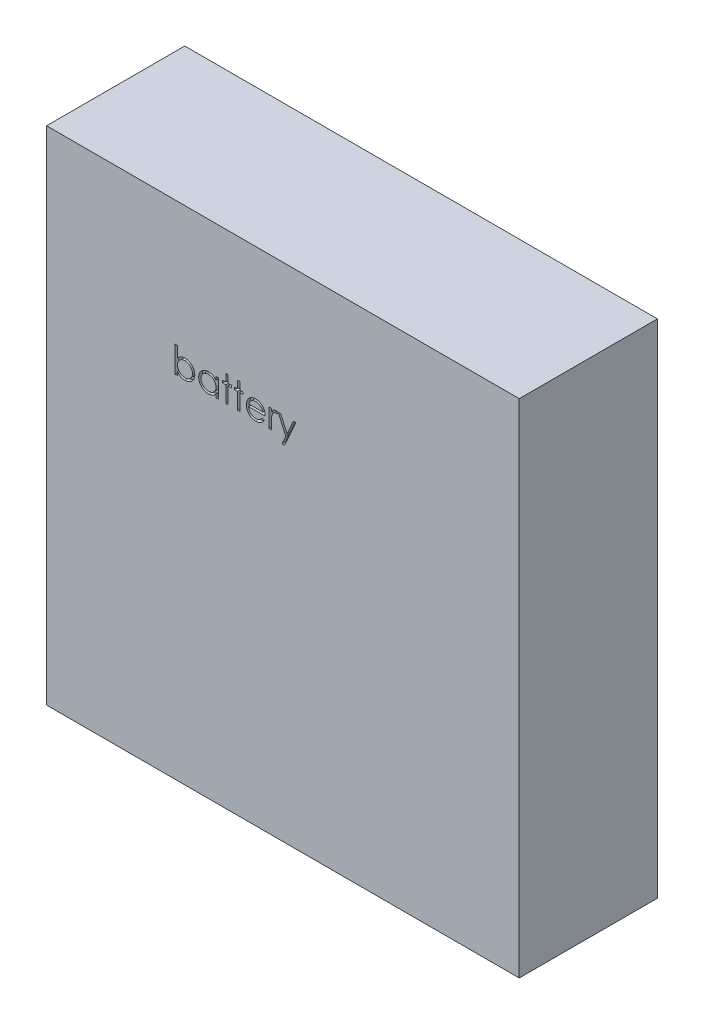
from build123d import *

# Parameters (mm, degrees)
SKETCH1_W           = 65
SKETCH1_H           = 69
BOSS_EXTRUDE1_DEPTH = 19
CUT_EXTRUDE1_DEPTH  = 0.5


with BuildPart() as part:
    # Sketch1 → Boss-Extrude1 (new body)
    with BuildSketch(Plane.XY):
        with Locations((32.5, 34.5)):
            Rectangle(SKETCH1_W, SKETCH1_H)
    extrude(amount=BOSS_EXTRUDE1_DEPTH)

    # Sketch2 → Cut-Extrude1 (cut)
    # profile 1 of 7: a face of its own
    with BuildSketch(Plane.XY.offset(19)):
        with BuildLine():
            Line((17.685046553, 48.241424132), (17.685046553, 51.831167722))
            Line((17.685046553, 51.831167722), (17.999149117, 51.831167722))
            Line((17.999149117, 51.831167722), (17.999149117, 50.334973811))
            add(Edge.make_bspline(
                [(17.999149117, 50.334973811), (18.034542536, 50.375731743), (18.103596556, 50.455252149), (18.219373007, 50.559099798), (18.340778576, 50.647152276), (18.468736832, 50.719738394), (18.603429765, 50.775012001), (18.744161874, 50.815434391), (18.891292915, 50.839821294), (18.991612089, 50.842587367), (19.042418348, 50.843988234)],
                knots=[0, 0, 0, 0, 1.077089805, 2.101446609, 3.097517232, 4.067117542, 5.031729543, 5.997785507, 6.985986182, 8, 8, 8, 8], degree=3))
            add(Edge.make_bspline(
                [(19.042418348, 50.843988234), (19.087584486, 50.842748006), (19.176885638, 50.840295864), (19.308167785, 50.821661368), (19.43448106, 50.791443567), (19.555756708, 50.749551387), (19.67142884, 50.69396841), (19.782487897, 50.627427102), (19.888364882, 50.548188773), (19.987419767, 50.457590462), (20.078713654, 50.359233839), (20.158626164, 50.254053524), (20.22612586, 50.143578434), (20.281957153, 50.028178371), (20.325128205, 49.90738202), (20.354870473, 49.781307822), (20.373763937, 49.650079803), (20.376144183, 49.560766999), (20.377354245, 49.515362433)],
                knots=[0, 0, 0, 0, 1.034377878, 2.045141349, 3.03070803, 4.00595497, 4.978199603, 5.965204761, 6.967410914, 8.002051993, 9.036360596, 10.037508045, 11.022711142, 11.997267194, 12.969246472, 13.954813154, 14.960274251, 16, 16, 16, 16], degree=3))
            add(Edge.make_bspline(
                [(20.377354245, 49.515362433), (20.376117805, 49.470662415), (20.373679739, 49.38252102), (20.355058431, 49.252814464), (20.324312166, 49.127975765), (20.280350983, 49.008327507), (20.225086044, 48.893307594), (20.155974768, 48.78422719), (20.076163769, 48.679188214), (19.98383262, 48.581564583), (19.883919068, 48.491331183), (19.777004825, 48.412925318), (19.665782903, 48.345208198), (19.548519791, 48.29155275), (19.426951749, 48.248151829), (19.299776363, 48.218034138), (19.167713135, 48.200461083), (19.077994246, 48.197865516), (19.032602643, 48.196552337)],
                knots=[0, 0, 0, 0, 1.024244038, 2.01964794, 2.996620209, 3.965911562, 4.936179293, 5.91563013, 6.920572822, 7.955171681, 8.990768464, 10.002129126, 10.989675881, 11.969873457, 12.952483066, 13.943799762, 14.959703725, 16, 16, 16, 16], degree=3))
            add(Edge.make_bspline(
                [(19.032602643, 48.196552337), (18.980637531, 48.197992945), (18.878743006, 48.200817727), (18.729690341, 48.224236706), (18.588608791, 48.264098316), (18.453891243, 48.317660072), (18.32746352, 48.390188726), (18.208522938, 48.480145476), (18.097819565, 48.589012613), (18.03260275, 48.672074103), (17.999149117, 48.714681343)],
                knots=[0, 0, 0, 0, 1.035807596, 2.031038093, 2.998900396, 3.954262848, 4.914341711, 5.895762244, 6.92060972, 8, 8, 8, 8], degree=3))
            Line((17.999149117, 48.714681343), (17.999149117, 48.241424132))
            Line((17.999149117, 48.241424132), (17.685046553, 48.241424132))
        make_face()
        with BuildLine():
            add(Edge.make_bspline(
                [(19.029798156, 48.510654901), (19.075712508, 48.51228853), (19.166340137, 48.515513054), (19.299383927, 48.540686677), (19.426698137, 48.582570791), (19.547641219, 48.639854499), (19.660320531, 48.711876534), (19.760973165, 48.799022704), (19.850452875, 48.898524219), (19.925104651, 49.010757912), (19.987430895, 49.130208881), (20.030244171, 49.255863183), (20.058963893, 49.384357972), (20.061816191, 49.471504016), (20.063251681, 49.515362433)],
                knots=[0, 0, 0, 0, 1.031910345, 2.036826888, 3.032245421, 4.038315463, 5.03827337, 6.029480047, 7.023177075, 8.037597977, 9.052889626, 10.043399556, 11.015292101, 12, 12, 12, 12], degree=3))
            add(Edge.make_bspline(
                [(20.063251681, 49.515362433), (20.061363937, 49.559177975), (20.057595986, 49.646634136), (20.031221203, 49.776283803), (19.985163413, 49.901871428), (19.92404539, 50.023049416), (19.848177405, 50.136057217), (19.759171441, 50.237547344), (19.657289635, 50.325107328), (19.544466216, 50.398097399), (19.424286025, 50.457656952), (19.297795392, 50.498501978), (19.167637269, 50.525240165), (19.079241776, 50.528329293), (19.034706008, 50.52988567)],
                knots=[0, 0, 0, 0, 0.984795267, 1.965658976, 2.959410029, 3.983795688, 5.009594896, 6.01088574, 7.009236619, 8.019050059, 9.024672985, 10.014834719, 10.999826153, 12, 12, 12, 12], degree=3))
            add(Edge.make_bspline(
                [(19.034706008, 50.52988567), (18.989238501, 50.528330173), (18.898994724, 50.525242826), (18.765826502, 50.498455002), (18.635763218, 50.457407391), (18.511475686, 50.398476041), (18.395621631, 50.326364581), (18.292009019, 50.241624381), (18.202677461, 50.144844473), (18.12913369, 50.036338671), (18.070728891, 49.919153636), (18.028945143, 49.794141433), (18.003945497, 49.66196012), (18.000767364, 49.571326915), (17.999149117, 49.525178138)],
                knots=[0, 0, 0, 0, 1.016820015, 2.018181405, 3.029022337, 4.06341356, 5.088169224, 6.076823655, 7.05054209, 8.02560866, 9.001194327, 9.972267242, 10.967515442, 12, 12, 12, 12], degree=3))
            add(Edge.make_bspline(
                [(17.999149117, 49.525178138), (18.000108788, 49.48984032), (18.001997723, 49.42028431), (18.016428091, 49.31815662), (18.039383753, 49.220423527), (18.071727247, 49.126978532), (18.114228482, 49.038352092), (18.165438747, 48.953856012), (18.226390394, 48.874252734), (18.295296983, 48.799737414), (18.371259364, 48.731927999), (18.452782483, 48.673149774), (18.538200414, 48.622535584), (18.628490384, 48.582190742), (18.722601675, 48.549264221), (18.821500016, 48.527530475), (18.92417144, 48.512555436), (18.994218538, 48.511295083), (19.029798156, 48.510654901)],
                knots=[0, 0, 0, 0, 1.050331198, 2.067384183, 3.060053655, 4.031335885, 5.001026174, 5.976994447, 6.963687968, 7.976578778, 8.990422448, 9.985569286, 10.960374351, 11.936812464, 12.921228065, 13.919088064, 14.943024695, 16, 16, 16, 16], degree=3))
        make_face(mode=Mode.SUBTRACT)
    # profile 2 of 7: a face of its own
    with BuildSketch(Plane.XY.offset(19)):
        with BuildLine():
            Line((23.608123476, 50.79911644), (23.608123476, 48.241424132))
            Line((23.608123476, 48.241424132), (23.294020912, 48.241424132))
            Line((23.294020912, 48.241424132), (23.294020912, 48.683831984))
            add(Edge.make_bspline(
                [(23.294020912, 48.683831984), (23.258602121, 48.643792391), (23.189481906, 48.565654619), (23.074040788, 48.463572447), (22.95167261, 48.379194125), (22.822971289, 48.31104421), (22.688053046, 48.259852153), (22.547216959, 48.223465994), (22.400405578, 48.200072159), (22.300153223, 48.197736137), (22.249349438, 48.196552337)],
                knots=[0, 0, 0, 0, 1.074387032, 2.096679803, 3.090159297, 4.057316773, 5.018401886, 5.985159533, 6.978961417, 8, 8, 8, 8], degree=3))
            add(Edge.make_bspline(
                [(22.249349438, 48.196552337), (22.204181484, 48.197778709), (22.115108279, 48.20019717), (21.984079202, 48.218959473), (21.857986952, 48.249090095), (21.73671238, 48.290990984), (21.621040234, 48.346571806), (21.509980138, 48.413113054), (21.404107446, 48.492353884), (21.305035907, 48.582941913), (21.213803906, 48.6813369), (21.133742634, 48.786282447), (21.066989554, 48.897324751), (21.011169473, 49.013057904), (20.968173129, 49.134372824), (20.938199494, 49.260849992), (20.919459048, 49.392339865), (20.917041587, 49.481879389), (20.915815784, 49.527281504)],
                knots=[0, 0, 0, 0, 1.033919861, 2.038935746, 3.024066025, 3.998881131, 4.97069526, 5.957263378, 6.95902576, 7.993208707, 9.027059324, 10.027763471, 11.009749337, 11.988697705, 12.965288445, 13.950418724, 14.960734635, 16, 16, 16, 16], degree=3))
            add(Edge.make_bspline(
                [(20.915815784, 49.527281504), (20.917068755, 49.571745207), (20.919545812, 49.659647551), (20.937999032, 49.788926249), (20.969030041, 49.913444509), (21.012577888, 50.032801453), (21.068419843, 50.147141503), (21.13634793, 50.256545528), (21.216367055, 50.361314925), (21.308619462, 50.458986152), (21.408554232, 50.549206766), (21.515462963, 50.627615812), (21.626686244, 50.695332661), (21.743949255, 50.748986137), (21.86551636, 50.792395241), (21.992469805, 50.822428209), (22.124281384, 50.840125531), (22.213771876, 50.842688295), (22.259165143, 50.843988234)],
                knots=[0, 0, 0, 0, 1.020392517, 2.01726096, 2.990465484, 3.961182959, 4.928053699, 5.906110375, 6.912531644, 7.948652711, 8.985773172, 9.998621852, 10.987621588, 11.969261332, 12.953316658, 13.946091881, 14.958173133, 16, 16, 16, 16], degree=3))
            add(Edge.make_bspline(
                [(22.259165143, 50.843988234), (22.311365002, 50.842550483), (22.413726462, 50.83973112), (22.563454471, 50.816268393), (22.705098949, 50.776629926), (22.839753301, 50.722712428), (22.966933987, 50.651063698), (23.085436971, 50.560683737), (23.196502455, 50.45214255), (23.260882746, 50.368772106), (23.294020912, 50.325859228)],
                knots=[0, 0, 0, 0, 1.038897134, 2.037228247, 3.008116434, 3.962042015, 4.918381754, 5.904844433, 6.921570401, 8, 8, 8, 8], degree=3))
            Line((23.294020912, 50.325859228), (23.294020912, 50.79911644))
            Line((23.294020912, 50.79911644), (23.608123476, 50.79911644))
        make_face()
        with BuildLine():
            add(Edge.make_bspline(
                [(22.263371874, 50.52988567), (22.217457536, 50.528252033), (22.126829936, 50.525027492), (21.993785934, 50.499853996), (21.86647252, 50.457969402), (21.745526445, 50.400687501), (21.632858229, 50.328658764), (21.532164558, 50.241537381), (21.442621857, 50.141700367), (21.367313592, 50.029598256), (21.305923095, 49.909420165), (21.262756063, 49.783795727), (21.234286816, 49.65499075), (21.231378295, 49.567628064), (21.229918348, 49.523775895)],
                knots=[0, 0, 0, 0, 1.031046209, 2.035121221, 3.029706178, 4.034933723, 5.034054252, 6.02443088, 7.017295772, 8.038157696, 9.050218397, 10.03989886, 11.016116709, 12, 12, 12, 12], degree=3))
            add(Edge.make_bspline(
                [(21.229918348, 49.523775895), (21.231783241, 49.480185788), (21.235505718, 49.393176432), (21.262256413, 49.264195855), (21.307136286, 49.138541813), (21.368378349, 49.017280819), (21.445064973, 48.904696719), (21.533953626, 48.802956596), (21.635903907, 48.715467008), (21.748831414, 48.642229435), (21.869439385, 48.583066914), (21.996273316, 48.541901274), (22.126948954, 48.515323494), (22.215801288, 48.512219017), (22.260567386, 48.510654901)],
                knots=[0, 0, 0, 0, 0.979072187, 1.954306742, 2.945804271, 3.96968567, 4.997920485, 5.998718438, 6.996577872, 8.005894225, 9.015743152, 10.005417472, 10.995077863, 12, 12, 12, 12], degree=3))
            add(Edge.make_bspline(
                [(22.260567386, 48.510654901), (22.306013889, 48.512314865), (22.396402476, 48.515616369), (22.529841184, 48.540897634), (22.659336146, 48.582666432), (22.783123375, 48.640565559), (22.898439506, 48.712322915), (23.001937384, 48.796330006), (23.089453352, 48.89403319), (23.163645961, 49.001409643), (23.221821378, 49.11912164), (23.264197437, 49.24445583), (23.289251343, 49.377416579), (23.292409073, 49.468280505), (23.294020912, 49.514661311)],
                knots=[0, 0, 0, 0, 1.01762866, 2.023962475, 3.030623092, 4.058876274, 5.077231937, 6.066672613, 7.034107872, 8.005628644, 8.981990164, 9.965428785, 10.961468474, 12, 12, 12, 12], degree=3))
            add(Edge.make_bspline(
                [(23.294020912, 49.514661311), (23.293061256, 49.549999142), (23.291172348, 49.619555175), (23.276741779, 49.721682693), (23.253786852, 49.819416419), (23.221440682, 49.912859108), (23.178949398, 50.001494123), (23.127701632, 50.085957884), (23.066796182, 50.165811095), (22.997213486, 50.239954166), (22.921048284, 50.307580628), (22.840453743, 50.367944869), (22.754474996, 50.417533642), (22.664557959, 50.458574913), (22.570546625, 50.491234063), (22.471676005, 50.513021757), (22.368997018, 50.527982078), (22.298950962, 50.529244459), (22.263371874, 50.52988567)],
                knots=[0, 0, 0, 0, 1.050140795, 2.067009409, 3.05949893, 4.030605086, 5.00011959, 5.97591094, 6.962425594, 7.979863591, 8.993523472, 9.986985069, 10.967611495, 11.937549037, 12.921786183, 13.919465291, 14.943216303, 16, 16, 16, 16], degree=3))
        make_face(mode=Mode.SUBTRACT)
    # profile 3 of 7: a face of its own
    with BuildSketch(Plane.XY.offset(19)):
        Polygon((24.640174758, 51.831167722), (24.954277322, 51.831167722), (24.954277322, 50.79911644), (25.402995271, 50.79911644), (25.402995271, 50.485013876), (24.954277322, 50.485013876), (24.954277322, 48.241424132), (24.640174758, 48.241424132), (24.640174758, 50.485013876), (24.191456809, 50.485013876), (24.191456809, 50.79911644), (24.640174758, 50.79911644), align=None)
    # profile 4 of 7: a face of its own
    with BuildSketch(Plane.XY.offset(19)):
        Polygon((26.255559374, 51.831167722), (26.569661938, 51.831167722), (26.569661938, 50.79911644), (27.018379886, 50.79911644), (27.018379886, 50.485013876), (26.569661938, 50.485013876), (26.569661938, 48.241424132), (26.255559374, 48.241424132), (26.255559374, 50.485013876), (25.806841425, 50.485013876), (25.806841425, 50.79911644), (26.255559374, 50.79911644), align=None)
    # profile 5 of 7: a face of its own
    with BuildSketch(Plane.XY.offset(19)):
        with BuildLine():
            Line((29.656000079, 49.04911644), (29.935046553, 48.902581984))
            add(Edge.make_bspline(
                [(29.935046553, 48.902581984), (29.912809958, 48.863138653), (29.869546349, 48.78639755), (29.795145601, 48.68096569), (29.717153529, 48.586117974), (29.632049561, 48.50438832), (29.542379882, 48.433136935), (29.447647227, 48.37079911), (29.347358409, 48.31768059), (29.241508685, 48.272928062), (29.129209133, 48.238518568), (29.010187617, 48.214214347), (28.884216122, 48.199191078), (28.797869942, 48.197445937), (28.753656329, 48.196552337)],
                knots=[0, 0, 0, 0, 1.120438281, 2.179929193, 3.190490725, 4.156257408, 5.095198341, 6.022838206, 6.959905092, 7.901321166, 8.864066838, 9.862729781, 10.905609505, 12, 12, 12, 12], degree=3))
            add(Edge.make_bspline(
                [(28.753656329, 48.196552337), (28.704514351, 48.197699512), (28.60865259, 48.199937319), (28.469112842, 48.219229784), (28.337733424, 48.250702142), (28.214521721, 48.294667684), (28.099779468, 48.352095008), (27.993278613, 48.42205449), (27.894459087, 48.504186744), (27.806434878, 48.599203188), (27.727190996, 48.700885145), (27.657265176, 48.80684103), (27.598807744, 48.916804254), (27.551255134, 49.030074778), (27.512850269, 49.145938672), (27.486083566, 49.265450139), (27.470653818, 49.388285723), (27.468289372, 49.471383059), (27.467097835, 49.513259068)],
                knots=[0, 0, 0, 0, 1.145258523, 2.234067595, 3.276747158, 4.290159414, 5.277019952, 6.260822364, 7.254936242, 8.264827045, 9.274100331, 10.257902744, 11.220704747, 12.172965371, 13.118907548, 14.062713208, 15.023725156, 16, 16, 16, 16], degree=3))
            add(Edge.make_bspline(
                [(27.467097835, 49.513259068), (27.468156976, 49.552553898), (27.470256055, 49.630431063), (27.483486842, 49.745696607), (27.506935135, 49.85772506), (27.539111459, 49.966609508), (27.580662705, 50.072167642), (27.631494925, 50.174463706), (27.691687302, 50.273388845), (27.738159976, 50.335791979), (27.761568989, 50.367225414)],
                knots=[0, 0, 0, 0, 1.024358464, 2.0301432, 3.019427413, 4.004406732, 4.986367066, 5.972626655, 6.978780325, 8, 8, 8, 8], degree=3))
            add(Edge.make_bspline(
                [(27.761568989, 50.367225414), (27.793276672, 50.405094284), (27.855687618, 50.479632435), (27.961243974, 50.57757076), (28.07554417, 50.659614535), (28.197155796, 50.727621672), (28.32749227, 50.779295319), (28.464801561, 50.817802901), (28.610647147, 50.839380912), (28.710352368, 50.842428745), (28.761368668, 50.843988234)],
                knots=[0, 0, 0, 0, 1.030682036, 2.02871468, 2.997146059, 3.962720338, 4.930598197, 5.918074684, 6.934738563, 8, 8, 8, 8], degree=3))
            add(Edge.make_bspline(
                [(28.761368668, 50.843988234), (28.813816274, 50.842634186), (28.91670652, 50.83997785), (29.066738641, 50.815351517), (29.208699357, 50.776298962), (29.342531862, 50.721145172), (29.468249722, 50.64998562), (29.585035772, 50.561843779), (29.694887284, 50.459425691), (29.758795863, 50.380662482), (29.791316585, 50.340582786)],
                knots=[0, 0, 0, 0, 1.056321875, 2.072262726, 3.055038591, 4.01806755, 4.982017516, 5.957941055, 6.960871419, 8, 8, 8, 8], degree=3))
            add(Edge.make_bspline(
                [(29.791316585, 50.340582786), (29.813443523, 50.310379204), (29.857550117, 50.250173086), (29.912797217, 50.152001929), (29.960754612, 50.049291334), (29.999087573, 49.940381037), (30.030127074, 49.826561457), (30.052583893, 49.707018912), (30.065753511, 49.581789001), (30.068342208, 49.496462445), (30.069661938, 49.452962593)],
                knots=[0, 0, 0, 0, 0.94817472, 1.890038105, 2.849395472, 3.817997239, 4.812318967, 5.836947057, 6.897266129, 8, 8, 8, 8], degree=3))
            Line((30.069661938, 49.452962593), (27.781200399, 49.452962593))
            add(Edge.make_bspline(
                [(27.781200399, 49.452962593), (27.782740006, 49.419262129), (27.78576758, 49.352991525), (27.799882723, 49.256020742), (27.822131497, 49.1636474), (27.853400559, 49.076564358), (27.891267404, 48.993634231), (27.937653121, 48.915472194), (27.992992675, 48.842434264), (28.054718375, 48.773867126), (28.12342547, 48.712806365), (28.195708217, 48.658154589), (28.272601782, 48.612348992), (28.353499866, 48.575169102), (28.438271651, 48.546062786), (28.526943846, 48.526194965), (28.619341962, 48.512887859), (28.682327696, 48.511408193), (28.714393508, 48.510654901)],
                knots=[0, 0, 0, 0, 1.094153842, 2.151609401, 3.174256925, 4.172055639, 5.149267565, 6.128595816, 7.11444997, 8.118368179, 9.117203808, 10.09244225, 11.054858984, 12.015122123, 12.976791628, 13.957293641, 14.960065497, 16, 16, 16, 16], degree=3))
            add(Edge.make_bspline(
                [(28.714393508, 48.510654901), (28.745744656, 48.511262958), (28.807951347, 48.512469459), (28.900592204, 48.52420137), (28.991731731, 48.543171645), (29.080992715, 48.569061635), (29.166563561, 48.600638488), (29.245809111, 48.638741345), (29.318689326, 48.680891092), (29.386806293, 48.729100767), (29.452877286, 48.788108954), (29.518419773, 48.861744675), (29.588696426, 48.948832203), (29.632686019, 49.014377869), (29.656000079, 49.04911644)],
                knots=[0, 0, 0, 0, 0.99110716, 1.966546729, 2.947904876, 3.932708344, 4.903319531, 5.828989031, 6.710028674, 7.56322171, 8.463672341, 9.504779593, 10.677557249, 12, 12, 12, 12], degree=3))
        make_face()
        with BuildLine():
            add(Edge.make_bspline(
                [(29.755559374, 49.767065158), (29.744062749, 49.808728031), (29.721935448, 49.888915652), (29.675699083, 49.999956542), (29.623627542, 50.098644443), (29.562005811, 50.184224076), (29.492187085, 50.260227589), (29.411541903, 50.326646175), (29.321106009, 50.386063626), (29.221346869, 50.436216125), (29.115705084, 50.478905984), (29.005098892, 50.5075311), (28.892241104, 50.527140642), (28.815906817, 50.52896675), (28.77749447, 50.52988567)],
                knots=[0, 0, 0, 0, 1.154881502, 2.222775134, 3.210006277, 4.132804581, 5.035138423, 5.962687519, 6.919655026, 7.923214229, 8.944639381, 9.960483929, 10.97369054, 12, 12, 12, 12], degree=3))
            add(Edge.make_bspline(
                [(28.77749447, 50.52988567), (28.746145031, 50.529273999), (28.684173782, 50.528064853), (28.592872714, 50.516594723), (28.505193015, 50.497634879), (28.420487727, 50.471669922), (28.339866859, 50.437061319), (28.261672091, 50.396478093), (28.187891695, 50.346936509), (28.141750399, 50.309177654), (28.118439983, 50.290102017)],
                knots=[0, 0, 0, 0, 1.04873581, 2.073130211, 3.073294108, 4.04793562, 5.032784715, 6.005352987, 6.992311501, 8, 8, 8, 8], degree=3))
            add(Edge.make_bspline(
                [(28.118439983, 50.290102017), (28.101746701, 50.275007701), (28.067963566, 50.244460485), (28.022823045, 50.191831278), (27.979602572, 50.135079716), (27.940268919, 50.072034592), (27.904191333, 50.003413813), (27.870431356, 49.929796177), (27.840044944, 49.850623047), (27.822948834, 49.795450608), (27.814153124, 49.767065158)],
                knots=[0, 0, 0, 0, 0.879870761, 1.780643979, 2.707998968, 3.669668524, 4.684282772, 5.740141944, 6.837334558, 8, 8, 8, 8], degree=3))
            Line((27.814153124, 49.767065158), (29.755559374, 49.767065158))
        make_face(mode=Mode.SUBTRACT)
    # profile 6 of 7: a face of its own
    with BuildSketch(Plane.XY.offset(19)):
        with BuildLine():
            Line((30.608123476, 50.79911644), (30.92222604, 50.79911644))
            Line((30.92222604, 50.79911644), (30.92222604, 50.422614036))
            add(Edge.make_bspline(
                [(30.92222604, 50.422614036), (30.945414799, 50.457669864), (30.98976312, 50.524713863), (31.063476049, 50.613383164), (31.138979381, 50.686798211), (31.216634568, 50.74530173), (31.297012668, 50.789114849), (31.37834962, 50.821207884), (31.461925089, 50.840185199), (31.518087014, 50.842718858), (31.546224438, 50.843988234)],
                knots=[0, 0, 0, 0, 1.2804753, 2.448899062, 3.506932113, 4.484331642, 5.4025378, 6.288909075, 7.142734305, 8, 8, 8, 8], degree=3))
            add(Edge.make_bspline(
                [(31.546224438, 50.843988234), (31.568050764, 50.842797708), (31.612959849, 50.840348122), (31.680942439, 50.823137297), (31.750985891, 50.795659275), (31.796128278, 50.769819052), (31.819661938, 50.75634801)],
                knots=[0, 0, 0, 0, 0.901110191, 1.854092781, 2.881294221, 4, 4, 4, 4], degree=3))
            Line((31.819661938, 50.75634801), (31.647185976, 50.484312754))
            add(Edge.make_bspline(
                [(31.647185976, 50.484312754), (31.632076955, 50.49105302), (31.60339714, 50.503847335), (31.561442574, 50.518989345), (31.522761237, 50.527905261), (31.498117679, 50.529255979), (31.486629085, 50.52988567)],
                knots=[0, 0, 0, 0, 1.180555205, 2.24091978, 3.179933427, 4, 4, 4, 4], degree=3))
            add(Edge.make_bspline(
                [(31.486629085, 50.52988567), (31.461423352, 50.528205633), (31.410010962, 50.524778844), (31.334526462, 50.497840036), (31.261279257, 50.454314796), (31.203107594, 50.406043684), (31.158065342, 50.359495887), (31.125925116, 50.318847484), (31.096442369, 50.273268852), (31.068272149, 50.223539169), (31.042605854, 50.168809323), (31.018651185, 50.109626109), (30.996992322, 50.04592098), (30.984642078, 50.00153846), (30.978315784, 49.97880394)],
                knots=[0, 0, 0, 0, 1.125678352, 2.296057538, 3.5422874, 4.923748041, 5.663163013, 6.437101912, 7.23742474, 8.08941207, 8.991984279, 9.93940061, 10.944477711, 12, 12, 12, 12], degree=3))
            add(Edge.make_bspline(
                [(30.978315784, 49.97880394), (30.97358339, 49.958526766), (30.963101499, 49.913614367), (30.952909961, 49.838265843), (30.942840443, 49.749242184), (30.935743825, 49.646295591), (30.929165782, 49.529683147), (30.9254557, 49.399227201), (30.92235256, 49.25479385), (30.922269493, 49.153819497), (30.92222604, 49.100999452)],
                knots=[0, 0, 0, 0, 0.566838948, 1.255505196, 2.06880316, 3.007127437, 4.065329342, 5.249902469, 6.561414163, 8, 8, 8, 8], degree=3))
            Line((30.92222604, 49.100999452), (30.92222604, 48.241424132))
            Line((30.92222604, 48.241424132), (30.608123476, 48.241424132))
            Line((30.608123476, 48.241424132), (30.608123476, 50.79911644))
        make_face()
    # profile 7 of 7: a face of its own
    with BuildSketch(Plane.XY.offset(19)):
        Polygon((31.864533733, 50.79911644), (32.202474438, 50.79911644), (33.069762098, 48.840182145), (33.948267707, 50.79911644), (34.287610656, 50.79911644), (32.717097835, 47.29911644), (32.377754886, 47.29911644), (32.900090624, 48.460875254), align=None)
    extrude(amount=-CUT_EXTRUDE1_DEPTH, mode=Mode.SUBTRACT)


solid = part.part
